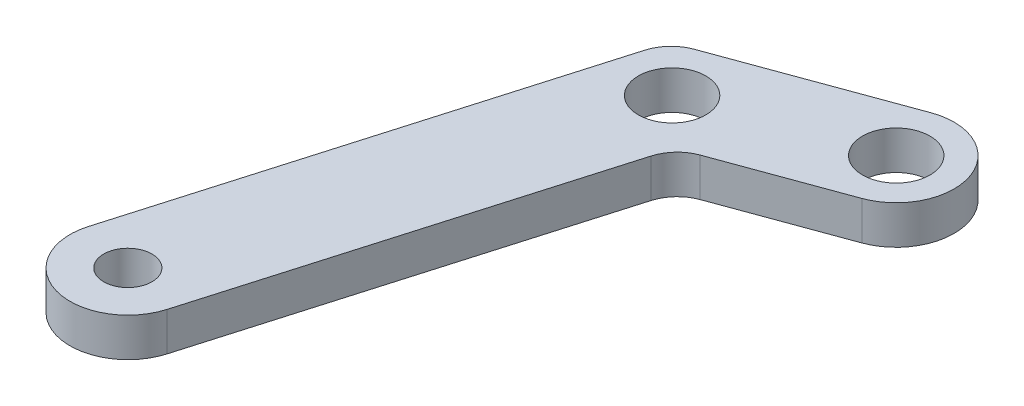
from build123d import *

# Parameters (mm, degrees)
BOSS_EXTRUDE1_OUTLINE_R   = 1.25
BOSS_EXTRUDE1_OUTLINE_R_2 = 1.75
BOSS_EXTRUDE1_DEPTH       = 2
FILLET1_R                 = 2


# Read off the part's stored shape, not the designer's step: Boss-Extrude1
with BuildPart() as part:
    # Boss-Extrude1 outline → Boss-Extrude1 (new body)
    with BuildSketch(Plane(origin=(0, 0, 0), x_dir=(1, 0, 0), z_dir=(0, 1, 0))):
        with BuildLine():
            ThreePointArc((-10888.259114433, 30381.23514527), (-10886.471579302, 30385.082835246), (-10890.319269278, 30386.870370378))
            Line((-10890.319269278, 30386.870370378), (-10900.252622841, 30383.238883421))
            Line((-10900.252622841, 30383.238883421), (-10907.03930171, 30359.932686135))
            ThreePointArc((-10907.03930171, 30359.932686135), (-10904.997689181, 30356.21357088), (-10901.278573926, 30358.255183408))
            Line((-10901.278573926, 30358.255183408), (-10895.340787747, 30378.646190381))
            Line((-10895.340787747, 30378.646190381), (-10888.259114433, 30381.23514527))
        make_face()
        with Locations((-10904.158937818, 30359.093934771)):
            Circle(BOSS_EXTRUDE1_OUTLINE_R, mode=Mode.SUBTRACT)
        with Locations((-10897.796705294, 30380.942536901)):
            Circle(BOSS_EXTRUDE1_OUTLINE_R_2, mode=Mode.SUBTRACT)
        with Locations((-10889.289191855, 30384.052757824)):
            Circle(BOSS_EXTRUDE1_OUTLINE_R_2, mode=Mode.SUBTRACT)
    extrude(amount=BOSS_EXTRUDE1_DEPTH)

    # Fillet1
    fillet1_edges = [part.edges().sort_by_distance(p)[0] for p in [
        (-10895.340787747, 1, -30378.646190381),
        (-10900.252622841, 1, -30383.238883421),
    ]]
    fillet(fillet1_edges, radius=FILLET1_R)


solid = part.part
